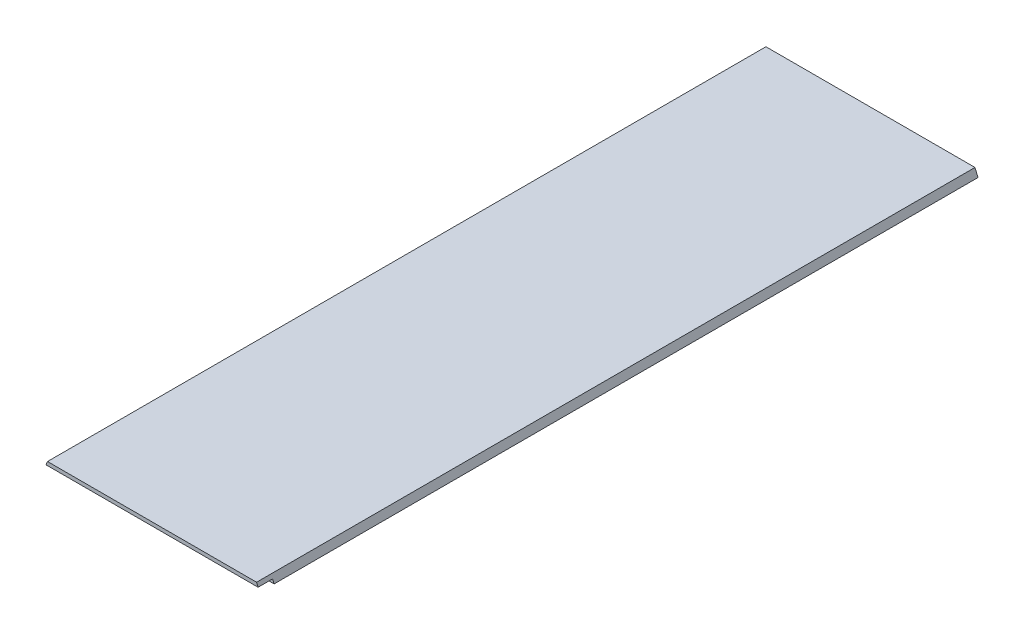
from build123d import *

# Parameters (mm, degrees)
BOSS_EXTRUDE1_DEPTH = 628.65
SKETCH2_W           = 188.214
SKETCH2_H           = 12.7
CUT_EXTRUDE1_DEPTH  = 3.175


with BuildPart() as part:
    # Sketch1 → Boss-Extrude1 (new body)
    with BuildSketch(Plane.XY):
        Polygon((0, 0), (2.630256121, 6.35), (185.583743879, 6.35), (188.214, 0), align=None)
    extrude(amount=BOSS_EXTRUDE1_DEPTH)

    # Sketch2 → Cut-Extrude1 (cut)
    with BuildSketch(Plane.XZ):
        with Locations((94.107, 622.3)):
            Rectangle(SKETCH2_W, SKETCH2_H)
    extrude(amount=-CUT_EXTRUDE1_DEPTH, mode=Mode.SUBTRACT)


solid = part.part
